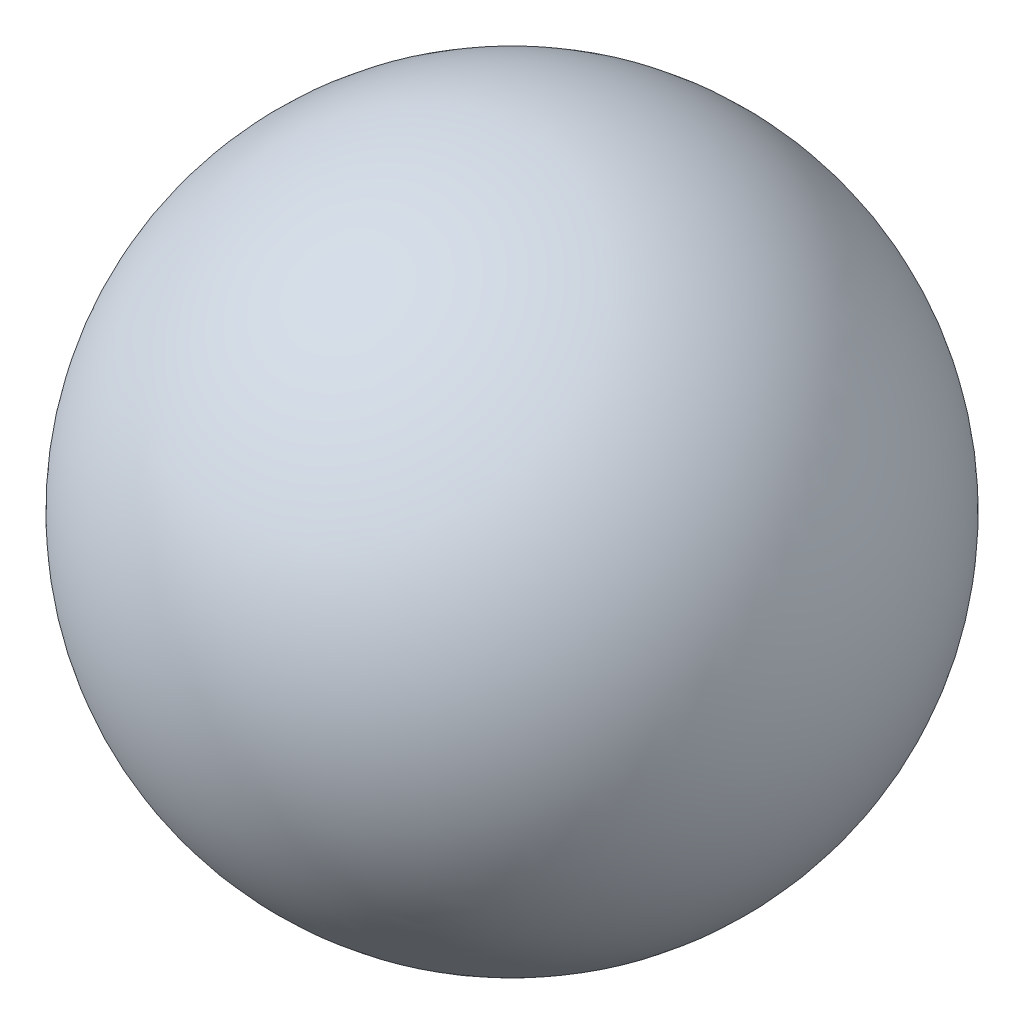
from build123d import *

# Parameters (mm, degrees)
SKETCH7_R          = 6.35
CUT_EXTRUDE1_DEPTH = 20.828


with BuildPart() as part:
    # Sketch2 → Revolve1 (revolve)
    with BuildSketch(Plane.XY):
        with BuildLine():
            Line((0, 31.75), (0, 0))
            ThreePointArc((0, 0), (11.225320151, 4.649679849), (15.875, 15.875))
            ThreePointArc((15.875, 15.875), (11.225320151, 27.100320151), (0, 31.75))
        make_face()
    revolve(axis=Axis((0, 0, 0), (0, 1, 0)))

    # Sketch7 → Cut-Extrude1 (cut)
    with BuildSketch(Plane.XY):
        with Locations((-0.558310545, 15.810579552)):
            Circle(SKETCH7_R)
    extrude(amount=-CUT_EXTRUDE1_DEPTH, mode=Mode.SUBTRACT)


solid = part.part
